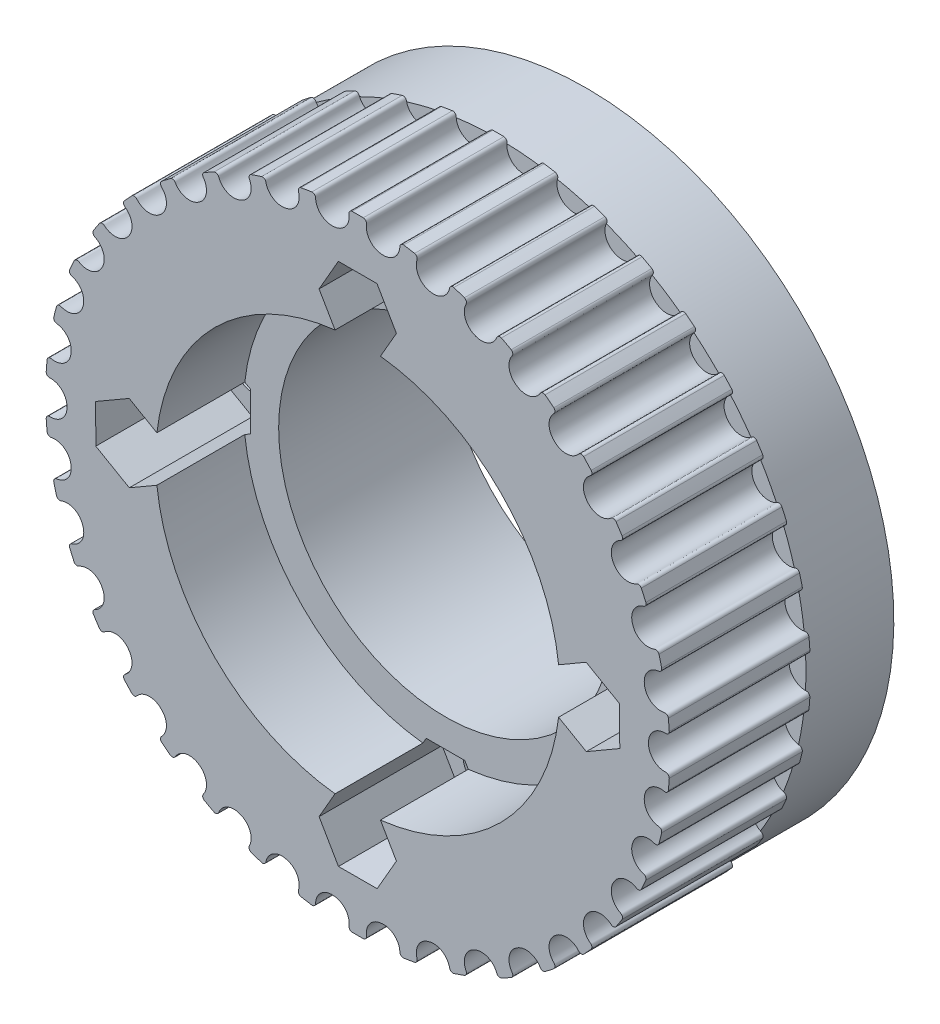
from build123d import *

# Parameters (mm, degrees)
TOOTHEXTRUDECUTGEARBELT01_DEPTH = 8.2296
PATTERNGEARBELT01_COUNT         = 38
BOREREVOLVESKETCH_W             = 19.5072
BOREREVOLVESKETCH_H             = 6.35
CUT_EXTRUDE_2_DEPTH             = 30.439215593
CUT_EXTRUDE_2_DEPTH_BACK        = 30.439215593
SKETCH_6_W                      = 23.542850768
SKETCH_6_H                      = 49.661884298
SKETCH_6_W_2                    = 10
SKETCH_6_H_2                    = 42.17926945
SKETCH_7_R                      = 19
SKETCH_7_R_2                    = 11
EXTRUDE_2_DEPTH                 = 1.5
SKETCH_8_R                      = 11
CUT_EXTRUDE_3_DEPTH             = 23.5
SKETCH_9_R                      = 11
SKETCH_9_R_2                    = 10
EXTRUDE_3_DEPTH                 = 13
CUT_EXTRUDE_START               = -20
CUT_EXTRUDE_4_OUTLINE_W         = 42
CUT_EXTRUDE_4_OUTLINE_H         = 1.5
CUT_EXTRUDE_4_DEPTH             = 40
EXTRUDE_START                   = -10
SKETCH_11_R                     = 10
EXTRUDE_4_DEPTH                 = 10
SKETCH_13_R                     = 3
CUT_EXTRUDE_6_DEPTH             = 28.011263736
SKETCH_14_R                     = 19.352437841
CUT_EXTRUDE_7_DEPTH             = 2
SKETCH_15_R                     = 11.5
CUT_EXTRUDE_8_DEPTH             = 27.336445626
SKETCH_17_R                     = 17.5
SKETCH_17_R_2                   = 11.5
EXTRUDE_6_DEPTH                 = 7
CUT_EXTRUDE_START_2             = -2
SKETCH_19_R                     = 17.5
CUT_EXTRUDE_9_DEPTH             = 2
EXTRUDE_START_2                 = -8
SKETCH_20_R                     = 11.5
SKETCH_20_R_2                   = 9.5
EXTRUDE_7_DEPTH                 = 8
CUT_EXTRUDE_10_DEPTH            = 27.336445596
CUT_EXTRUDE_10_DEPTH_BACK       = 27.336445596
SKETCH_21_R                     = 1
CUT_EXTRUDE_11_DEPTH            = 7
SKETCH_23_R                     = 10.5
SKETCH_23_R_2                   = 9.5
EXTRUDE_8_DEPTH                 = 1.5
CHAMFER_1_SIZE                  = 0.5


with BuildPart() as part:
    # SketchRevolveGearBelt01 → GearBelt01 (revolve)
    with BuildSketch(Plane(origin=(0, 0, 0), x_dir=(0, 0, -1), z_dir=(1, 0, 0)), mode=Mode.PRIVATE) as gearbelt01_sk:
        Polygon((9.7536, 0), (9.7536, 17.126361048), (8.9916, 17.126361048), (8.9916, 17.990789824), (9.554336648, 19.349356273), (8.850340445, 19.640961048), (8.2296, 18.142361048), (8.2296, 17.761361048), (-8.2296, 17.761361048), (-8.2296, 18.142361048), (-8.850340445, 19.640961048), (-9.554336648, 19.349356273), (-8.9916, 17.990789824), (-8.9916, 17.126361048), (-9.7536, 17.126361048), (-9.7536, 0), align=None)
    revolve(gearbelt01_sk.sketch.rotate(Axis((0, 0, 0), (0, 0, -1)), 90), axis=Axis((0, 0, 0), (0, 0, -1)))

    # SketchToothGearBelt01 → ToothExtrudeCutGearBelt01 (cut, symmetric)
    with BuildSketch(Plane.XY):
        with BuildLine():
            ThreePointArc((17.723656193, 1.158614958), (17.76148579, 0), (17.723656193, -1.158614958))
            add(Edge.make_bspline(
                [(17.723656193, -1.158614958), (17.724335676, -1.14823627), (17.724077281, -1.132585151), (17.721194158, -1.111966732), (17.717777417, -1.096730895), (17.713128932, -1.081824634), (17.707279735, -1.067347346), (17.70026882, -1.05339557), (17.692142941, -1.040062338), (17.682956281, -1.027436561), (17.672770099, -1.015602429), (17.66165232, -1.004638853), (17.649677079, -0.994618949), (17.63692423, -0.9856095), (17.62347881, -0.977670704), (17.60943048, -0.970855044), (17.594872907, -0.96520967), (17.579903201, -0.960765872), (17.564621042, -0.957576996), (17.549128869, -0.95557581), (17.516665111, -0.954598043), (17.465194615, -0.955658717), (17.394665001, -0.952974324), (17.322442429, -0.94419054), (17.251120537, -0.929864538), (17.181142601, -0.909971652), (17.112937405, -0.88466435), (17.046924504, -0.854090084), (16.983509536, -0.818438939), (16.923082288, -0.777929454), (16.866014153, -0.732810765), (16.812655887, -0.683360139), (16.76333544, -0.629881524), (16.718355954, -0.572703607), (16.677993853, -0.512177819), (16.642497327, -0.44867616), (16.612084116, -0.382588948), (16.586942746, -0.314322278), (16.567221777, -0.244296084), (16.553064674, -0.172939449), (16.544475394, -0.100695852), (16.542532207, -0.047557361), (16.542623513, -0.014000083), (16.542610816, 0), (16.542623513, 0.014000083), (16.542532207, 0.047557361), (16.544475394, 0.100695852), (16.553064674, 0.172939449), (16.567221777, 0.244296084), (16.586942746, 0.314322278), (16.612084116, 0.382588948), (16.642497327, 0.44867616), (16.677993853, 0.512177819), (16.718355954, 0.572703607), (16.76333544, 0.629881524), (16.812655887, 0.683360139), (16.866014153, 0.732810765), (16.923082288, 0.777929454), (16.983509536, 0.818438939), (17.046924504, 0.854090084), (17.112937405, 0.88466435), (17.181142601, 0.909971652), (17.251120537, 0.929864538), (17.322442429, 0.94419054), (17.394665001, 0.952974324), (17.465194615, 0.955658717), (17.516665111, 0.954598043), (17.549128869, 0.95557581), (17.564621042, 0.957576996), (17.579903201, 0.960765872), (17.594872907, 0.96520967), (17.60943048, 0.970855044), (17.62347881, 0.977670704), (17.63692423, 0.9856095), (17.649677079, 0.994618949), (17.66165232, 1.004638853), (17.672770099, 1.015602429), (17.682956281, 1.027436561), (17.692142941, 1.040062338), (17.70026882, 1.05339557), (17.707279735, 1.067347346), (17.713128932, 1.081824634), (17.717777417, 1.096730895), (17.721194158, 1.111966732), (17.724077281, 1.132585151), (17.724335676, 1.14823627), (17.723656193, 1.158614958)],
                knots=[0, 0, 0, 0, 0.008387202, 0.012580803, 0.016774404, 0.020968005, 0.025161606, 0.029355207, 0.033548808, 0.037742409, 0.04193601, 0.046129611, 0.050323212, 0.054516813, 0.058710414, 0.062904015, 0.067097616, 0.071291217, 0.075484818, 0.079678419, 0.08387202, 0.101664119, 0.121204489, 0.14074486, 0.16028523, 0.179825601, 0.199365971, 0.218906342, 0.238446712, 0.257987083, 0.277527453, 0.297067824, 0.316608194, 0.336148565, 0.355688935, 0.375229306, 0.394769676, 0.414310047, 0.433850417, 0.453390788, 0.472931158, 0.492471529, 0.496235765, 0.5, 0.503764235, 0.507528471, 0.527068842, 0.546609212, 0.566149583, 0.585689953, 0.605230324, 0.624770694, 0.644311065, 0.663851435, 0.683391806, 0.702932176, 0.722472547, 0.742012917, 0.761553288, 0.781093658, 0.800634029, 0.820174399, 0.83971477, 0.85925514, 0.878795511, 0.898335881, 0.91612798, 0.920321581, 0.924515182, 0.928708783, 0.932902384, 0.937095985, 0.941289586, 0.945483187, 0.949676788, 0.953870389, 0.95806399, 0.962257591, 0.966451192, 0.970644793, 0.974838394, 0.979031995, 0.983225596, 0.987419197, 0.991612798, 1, 1, 1, 1], degree=3))
        make_face()
    toothextrudecutgearbelt01 = extrude(amount=TOOTHEXTRUDECUTGEARBELT01_DEPTH, both=True, mode=Mode.SUBTRACT)

    # PatternGearBelt01: ToothExtrudeCutGearBelt01 ×38 about axis
    patterngearbelt01_axis = Axis((0, 0, 55), (0, 0, -1))
    for i in range(1, PATTERNGEARBELT01_COUNT):
        add(toothextrudecutgearbelt01.rotate(patterngearbelt01_axis, i * 360 / PATTERNGEARBELT01_COUNT), mode=Mode.SUBTRACT)

    # BoreRevolveSketch → BoreRevolveCut (revolve, cut)
    with BuildSketch(Plane(origin=(0, 0, 0), x_dir=(0, 0, -1), z_dir=(1, 0, 0)), mode=Mode.PRIVATE) as borerevolvecut_sk:
        with Locations((0, 3.175)):
            Rectangle(BOREREVOLVESKETCH_W, BOREREVOLVESKETCH_H)
    revolve(borerevolvecut_sk.sketch.rotate(Axis((0, 0, 0), (0, 0, -1)), 90), axis=Axis((0, 0, 0), (0, 0, -1)), mode=Mode.SUBTRACT)

    # 草图6 → 切除-拉伸2 (cut, two sides: drawn at the far end of the back side and taken through both)
    with BuildSketch(Plane(origin=(0, 0, 0), x_dir=(0, 0, -1), z_dir=(1, 0, 0)).offset(-CUT_EXTRUDE_2_DEPTH_BACK)):
        Rectangle(SKETCH_6_W, SKETCH_6_H)
        Rectangle(SKETCH_6_W_2, SKETCH_6_H_2, mode=Mode.SUBTRACT)
    extrude(amount=CUT_EXTRUDE_2_DEPTH + CUT_EXTRUDE_2_DEPTH_BACK, mode=Mode.SUBTRACT)

    # 草图7 → 凸台-拉伸2 (add)
    with BuildSketch(Plane.XY.offset(5)):
        Circle(SKETCH_7_R)
        Circle(SKETCH_7_R_2, mode=Mode.SUBTRACT)
    extrude_2 = extrude(amount=EXTRUDE_2_DEPTH)

    # 镜向1: 凸台-拉伸2 across plane
    add(extrude_2.mirror(Plane.XY))

    # 草图8 → 切除-拉伸3 (cut)
    with BuildSketch(Plane.XY.offset(5)):
        Circle(SKETCH_8_R)
    extrude(amount=-CUT_EXTRUDE_3_DEPTH, mode=Mode.SUBTRACT)

    # 草图9 → 凸台-拉伸3 (add)
    with BuildSketch(Plane.XY.offset(6.5)):
        Circle(SKETCH_9_R)
        Circle(SKETCH_9_R_2, mode=Mode.SUBTRACT)
    extrude(amount=-EXTRUDE_3_DEPTH)

    # 切除-拉伸4: read off the stored shape, not the designer's step
    # 切除-拉伸4 outline → 切除-拉伸4 (cut)
    with BuildSketch(Plane(origin=(0, 0, 0), x_dir=(1, 0, 0), z_dir=(0, 1, 0)).offset(CUT_EXTRUDE_START)):
        with Locations((0, 5.75)):
            Rectangle(CUT_EXTRUDE_4_OUTLINE_W, CUT_EXTRUDE_4_OUTLINE_H)
        with Locations((0, -5.75)):
            Rectangle(CUT_EXTRUDE_4_OUTLINE_W, CUT_EXTRUDE_4_OUTLINE_H)
    extrude(amount=CUT_EXTRUDE_4_DEPTH, mode=Mode.SUBTRACT)

    # 草图11 → 凸台-拉伸4 (add)
    with BuildSketch(Plane(origin=(0, 0, -5), x_dir=(-1, 0, 0), z_dir=(0, 0, -1)).offset(EXTRUDE_START)):
        Circle(SKETCH_11_R)
    extrude(amount=EXTRUDE_4_DEPTH)

    # 草图13 → 切除-拉伸6 (cut, through all)
    with BuildSketch(Plane(origin=(0, 0, -5), x_dir=(-1, 0, 0), z_dir=(0, 0, -1))):
        Circle(SKETCH_13_R)
    extrude(amount=-CUT_EXTRUDE_6_DEPTH, mode=Mode.SUBTRACT)

    # 草图14 → 切除-拉伸7 (cut)
    with BuildSketch(Plane.XY.offset(5)):
        Circle(SKETCH_14_R)
    extrude(amount=-CUT_EXTRUDE_7_DEPTH, mode=Mode.SUBTRACT)

    # 草图15 → 切除-拉伸8 (cut, through all)
    with BuildSketch(Plane.XY.offset(3)):
        Circle(SKETCH_15_R)
    extrude(amount=-CUT_EXTRUDE_8_DEPTH, mode=Mode.SUBTRACT)

    # 草图17 → 凸台-拉伸6 (add)
    with BuildSketch(Plane(origin=(0, 0, -5), x_dir=(-1, 0, 0), z_dir=(0, 0, -1))):
        with Locations(Location((0, 0, 0), (0, 0, 176.871638885))):
            Circle(SKETCH_17_R)
        with Locations(Location((0, 0, 0), (0, 0, 180))):
            Circle(SKETCH_17_R_2, mode=Mode.SUBTRACT)
    extrude(amount=EXTRUDE_6_DEPTH)

    # 草图19 → 切除-拉伸9 (cut)
    with BuildSketch(Plane(origin=(0, 0, -12), x_dir=(-1, 0, 0), z_dir=(0, 0, -1)).offset(CUT_EXTRUDE_START_2)):
        with Locations(Location((0, 0, 0), (0, 0, 176.871638885))):
            Circle(SKETCH_19_R)
    extrude(amount=CUT_EXTRUDE_9_DEPTH, mode=Mode.SUBTRACT)

    # 草图20 → 凸台-拉伸7 (add)
    with BuildSketch(Plane(origin=(0, 0, -10), x_dir=(-1, 0, 0), z_dir=(0, 0, -1)).offset(EXTRUDE_START_2)):
        with Locations(Location((0, 0, 0), (0, 0, 180))):
            Circle(SKETCH_20_R)
        Circle(SKETCH_20_R_2, mode=Mode.SUBTRACT)
    extrude(amount=EXTRUDE_7_DEPTH)

    # 草图21 → 切除-拉伸10 (cut, two sides: drawn at the far end of the back side and taken through both)
    with BuildSketch(Plane.XY.offset(-2).offset(-CUT_EXTRUDE_10_DEPTH_BACK)):
        with Locations((0, 13)):
            Circle(SKETCH_21_R)
        with Locations((13, 0)):
            Circle(SKETCH_21_R)
        with Locations((0, -13)):
            Circle(SKETCH_21_R)
        with Locations((-13, 0)):
            Circle(SKETCH_21_R)
    extrude(amount=CUT_EXTRUDE_10_DEPTH + CUT_EXTRUDE_10_DEPTH_BACK, mode=Mode.SUBTRACT)

    # 草图22 → 切除-拉伸11 (cut)
    with BuildSketch(Plane.XY.offset(3)):
        Polygon((11.096948382, -1.103809105), (13.004400917, -2.199995598), (14.907452535, -1.096186493), (14.903051618, 1.103809105), (12.995599083, 2.199995598), (11.092547465, 1.096186493), align=None)
        Polygon((-1.096186493, 11.092547465), (1.103809105, 11.096948382), (2.199995598, 13.004400917), (1.096186493, 14.907452535), (-1.103809105, 14.903051618), (-2.199995598, 12.995599083), align=None)
        Polygon((-1.103809105, -11.096948382), (-2.199995598, -13.004400917), (-1.096186493, -14.907452535), (1.103809105, -14.903051618), (2.199995598, -12.995599083), (1.096186493, -11.092547465), align=None)
        Polygon((-11.096948382, 1.103809105), (-13.004400917, 2.199995598), (-14.907452535, 1.096186493), (-14.903051618, -1.103809105), (-12.995599083, -2.199995598), (-11.092547465, -1.096186493), align=None)
    extrude(amount=-CUT_EXTRUDE_11_DEPTH, mode=Mode.SUBTRACT)

    # 草图23 → 凸台-拉伸8 (add)
    with BuildSketch(Plane(origin=(0, 0, -10), x_dir=(-1, 0, 0), z_dir=(0, 0, -1))):
        Circle(SKETCH_23_R)
        Circle(SKETCH_23_R_2, mode=Mode.SUBTRACT)
    extrude(amount=EXTRUDE_8_DEPTH)

    # 倒角1
    chamfer_1_edges = [part.edges().sort_by_distance(p)[0] for p in [
        (10.5, 0, -11.5),
    ]]
    chamfer(chamfer_1_edges, length=CHAMFER_1_SIZE)


solid = part.part
